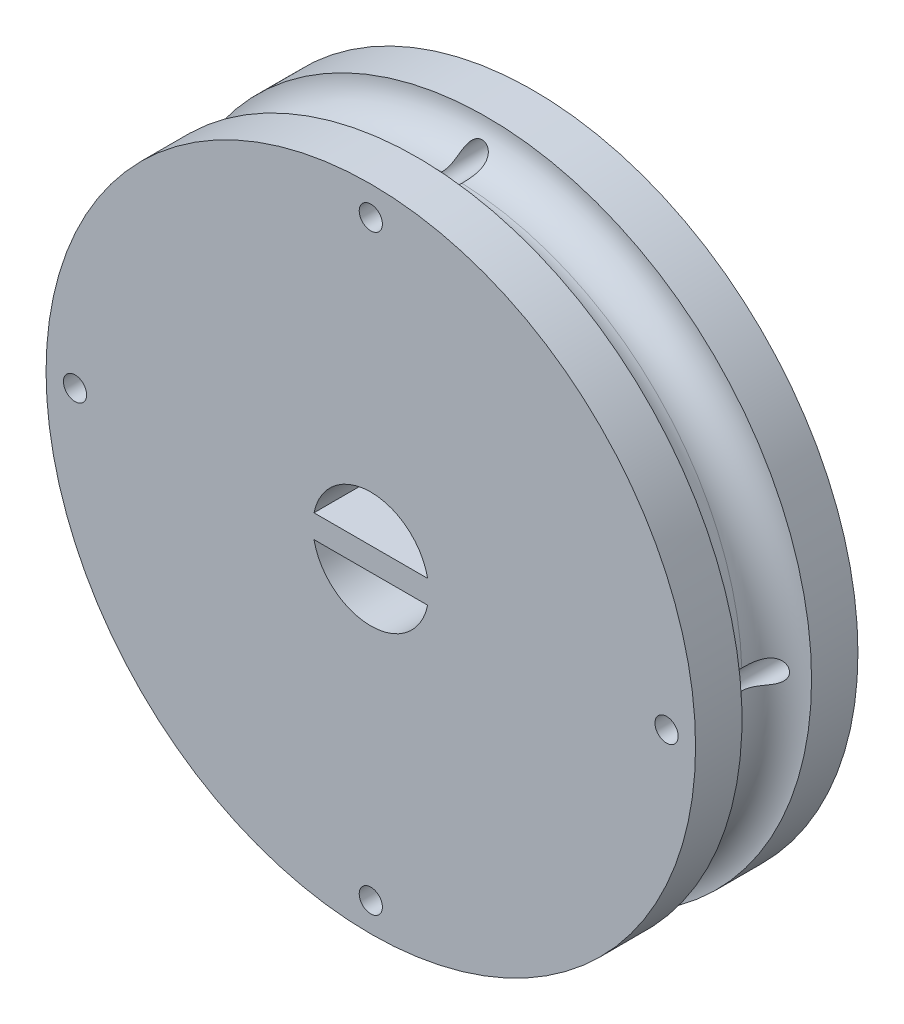
from build123d import *

# Parameters (mm, degrees)
SKETCH1_R               = 14
BOSS_EXTRUDE1_DEPTH     = 7
SKETCH3_R               = 2.5
CUT_EXTRUDE1_DEPTH      = 22
SKETCH4_W               = 5
SKETCH4_H               = 1
BOSS_EXTRUDE2_DEPTH     = 2
SKETCH5_R               = 12
SKETCH5_R_2             = 3.5
CUT_EXTRUDE2_DEPTH      = 5
SKETCH6_W               = 7
SKETCH6_H               = 2.5
CUT_EXTRUDE3_DEPTH      = 5
SKETCH7_R               = 14
SKETCH7_R_2             = 12.5
CUT_EXTRUDE4_DEPTH      = 5
SKETCH8_R               = 14
SKETCH8_R_2             = 12.5
BOSS_EXTRUDE3_DEPTH     = 2
FILLET1_R               = 1.5
CUT_EXTRUDE7_DEPTH      = 22
CUT_EXTRUDE7_DEPTH_BACK = 22
SKETCH9_R               = 0.5
SKETCH10_W              = 6.874413596
SKETCH10_H              = 7.54594332
CUT_EXTRUDE8_DEPTH      = 2


with BuildPart() as part:
    # Sketch1 → Boss-Extrude1 (new body)
    with BuildSketch(Plane.XY):
        Circle(SKETCH1_R)
    extrude(amount=BOSS_EXTRUDE1_DEPTH)

    # Sketch3 → Cut-Extrude1 (cut, through all)
    with BuildSketch(Plane(origin=(0, 0, 0), x_dir=(-1, 0, 0), z_dir=(0, 0, -1))):
        Circle(SKETCH3_R)
    extrude(amount=-CUT_EXTRUDE1_DEPTH, mode=Mode.SUBTRACT)

    # Sketch4 → Boss-Extrude2 (add)
    with BuildSketch(Plane.XY.offset(7)):
        Rectangle(SKETCH4_W, SKETCH4_H)
    extrude(amount=-BOSS_EXTRUDE2_DEPTH)

    # Sketch5 → Cut-Extrude2 (cut)
    with BuildSketch(Plane(origin=(0, 0, 0), x_dir=(-1, 0, 0), z_dir=(0, 0, -1))):
        Circle(SKETCH5_R)
        Circle(SKETCH5_R_2, mode=Mode.SUBTRACT)
    extrude(amount=-CUT_EXTRUDE2_DEPTH, mode=Mode.SUBTRACT)

    # Sketch6 → Cut-Extrude3 (cut)
    with BuildSketch(Plane(origin=(0, 0, 0), x_dir=(-1, 0, 0), z_dir=(0, 0, -1))):
        Rectangle(SKETCH6_W, SKETCH6_H)
    extrude(amount=-CUT_EXTRUDE3_DEPTH, mode=Mode.SUBTRACT)

    # Sketch7 → Cut-Extrude4 (cut)
    with BuildSketch(Plane(origin=(0, 0, 0), x_dir=(-1, 0, 0), z_dir=(0, 0, -1))):
        Circle(SKETCH7_R)
        Circle(SKETCH7_R_2, mode=Mode.SUBTRACT)
    extrude(amount=-CUT_EXTRUDE4_DEPTH, mode=Mode.SUBTRACT)

    # Sketch8 → Boss-Extrude3 (add)
    with BuildSketch(Plane.XY):
        with Locations(Location((0, 0, 0), (0, 0, 180))):
            Circle(SKETCH8_R)
        with Locations(Location((0, 0, 0), (0, 0, 180))):
            Circle(SKETCH8_R_2, mode=Mode.SUBTRACT)
    extrude(amount=BOSS_EXTRUDE3_DEPTH)

    # Fillet1
    fillet1_edges = [part.edges().sort_by_distance(p)[0] for p in [
        (12.5, 0, 5),
        (12.5, 0, 2),
    ]]
    fillet(fillet1_edges, radius=FILLET1_R - 0.0001)  # a hair under: the kernel refuses the full size

    # Sketch9 → Cut-Extrude7 (cut, two sides: drawn at the far end of the back side and taken through both)
    with BuildSketch(Plane(origin=(0, 0, 0), x_dir=(-1, 0, 0), z_dir=(0, 0, -1)).offset(-CUT_EXTRUDE7_DEPTH_BACK)):
        with Locations((-12.75, 0)):
            Circle(SKETCH9_R)
        with Locations((12.75, 0)):
            Circle(SKETCH9_R)
        with Locations((0, 12.75)):
            Circle(SKETCH9_R)
        with Locations((0, -12.75)):
            Circle(SKETCH9_R)
    extrude(amount=CUT_EXTRUDE7_DEPTH + CUT_EXTRUDE7_DEPTH_BACK, mode=Mode.SUBTRACT)

    # Sketch10 → Cut-Extrude8 (cut)
    with BuildSketch(Plane(origin=(0, 0, 0), x_dir=(-1, 0, 0), z_dir=(0, 0, -1))):
        with Locations((0.008465514, -0.14973146)):
            Rectangle(SKETCH10_W, SKETCH10_H)
    extrude(amount=-CUT_EXTRUDE8_DEPTH, mode=Mode.SUBTRACT)


solid = part.part
